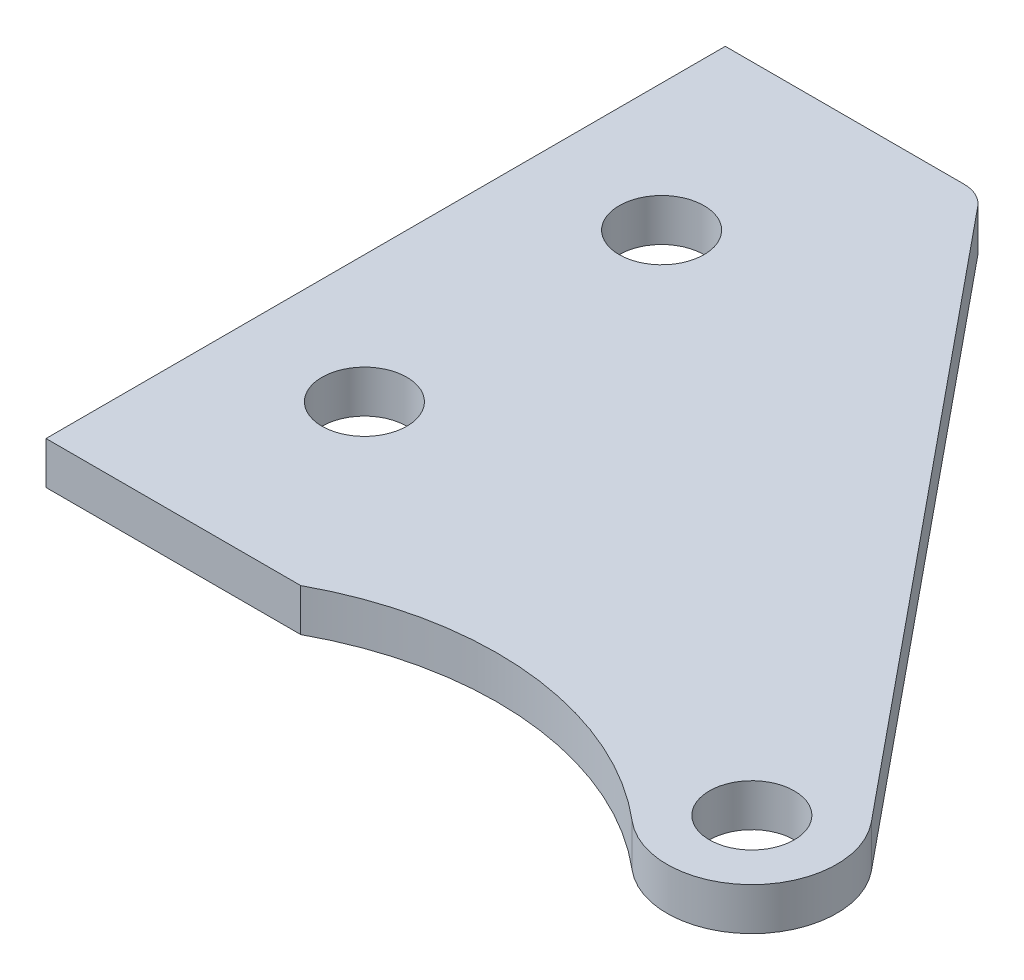
from build123d import *

# Parameters (mm, degrees)
BOSS_EXTRUDE1_DEPTH         = 3.175
F_1_4_0_25_DIAMETER_HOLE2_D = 6.35
F_1_4_0_25_DIAMETER_HOLE1_D = 6.35
FILLET1_R                   = 2.54


with BuildPart() as part:
    # Sketch1 → Boss-Extrude1 (new body)
    with BuildSketch(Plane(origin=(0, 0, 0), x_dir=(1, 0, 0), z_dir=(0, 1, 0))):
        with BuildLine():
            Line((0, 50.8), (19.05, 50.8))
            Line((19.05, 50.8), (55.713742815, 6.00889778))
            ThreePointArc((55.713742815, 6.00889778), (55.251600463, -2.541572748), (46.694481495, -2.857542328))
            ThreePointArc((46.694481495, -2.857542328), (33.314239893, 2.847224007), (19.05, 0))
            Line((19.05, 0), (0, 0))
            Line((0, 0), (0, 50.8))
        make_face()
    extrude(amount=BOSS_EXTRUDE1_DEPTH)

    # 1/4 (0.25) Diameter Hole2 (through all)
    with Locations(Plane(origin=(0, 0, 0), x_dir=(-1, 0, 0), z_dir=(0, -1, 0))):
        with Locations((-50.8, 1.986755124)):
            Hole(F_1_4_0_25_DIAMETER_HOLE2_D / 2)

    # 1/4 (0.25) Diameter Hole1 (through all)
    with Locations(Plane(origin=(0, 3.175, 0), x_dir=(1, 0, 0), z_dir=(0, 1, 0))):
        with Locations((9.525, 36.5125), (9.525, 14.2875)):
            Hole(F_1_4_0_25_DIAMETER_HOLE1_D / 2)

    # Fillet1
    fillet1_edges = [part.edges().sort_by_distance(p)[0] for p in [
        (19.05, 1.5875, -50.8),
    ]]
    fillet(fillet1_edges, radius=FILLET1_R)


solid = part.part
